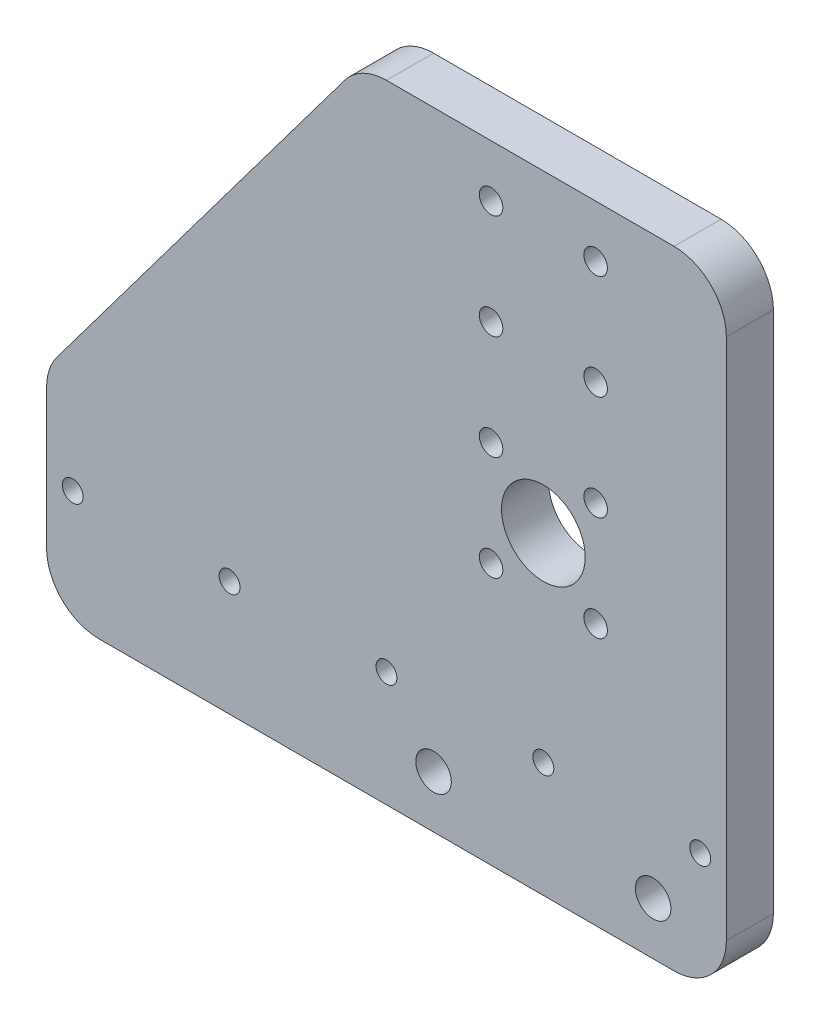
from build123d import *

# Parameters (mm, degrees)
BOSS_EXTRU_1_DEPTH      = 9
ESQUISSE2_R             = 2
ESQUISSE2_R_2           = 2.25
ENL_V_MAT_EXTRU_1_DEPTH = 178.146831753
ESQUISSE3_R             = 8
ESQUISSE3_R_2           = 3.4
ENL_V_MAT_EXTRU_2_DEPTH = 178.146831753
CONG_1_R                = 10


with BuildPart() as part:
    # Esquisse1 → Boss.-Extru.1 (new body)
    with BuildSketch(Plane.XY):
        Polygon((0, 0), (130, 0), (130, 120), (60, 120), (0, 40), align=None)
    extrude(amount=BOSS_EXTRU_1_DEPTH)

    # Esquisse2 → Enlèv. mat.-Extru.1 (cut, through all)
    with BuildSketch(Plane.XY.offset(9)):
        with Locations((65, 22)):
            Circle(ESQUISSE2_R)
        with Locations((35, 22)):
            Circle(ESQUISSE2_R)
        with Locations((5, 22)):
            Circle(ESQUISSE2_R)
        with Locations((125, 22)):
            Circle(ESQUISSE2_R)
        with Locations((95, 22)):
            Circle(ESQUISSE2_R)
        with Locations((85, 110)):
            Circle(ESQUISSE2_R_2)
        with Locations((85, 90)):
            Circle(ESQUISSE2_R_2)
        with Locations((105, 90)):
            Circle(ESQUISSE2_R_2)
        with Locations((105, 110)):
            Circle(ESQUISSE2_R_2)
        with Locations((105, 50)):
            Circle(ESQUISSE2_R_2)
        with Locations((105, 70)):
            Circle(ESQUISSE2_R_2)
        with Locations((85, 70)):
            Circle(ESQUISSE2_R_2)
        with Locations((85, 50)):
            Circle(ESQUISSE2_R_2)
    extrude(amount=-ENL_V_MAT_EXTRU_1_DEPTH, mode=Mode.SUBTRACT)

    # Esquisse3 → Enlèv. mat.-Extru.2 (cut, through all)
    with BuildSketch(Plane.XY.offset(9)):
        with Locations((95, 60)):
            Circle(ESQUISSE3_R)
        with Locations((74, 10)):
            Circle(ESQUISSE3_R_2)
        with Locations((116, 10)):
            Circle(ESQUISSE3_R_2)
    extrude(amount=-ENL_V_MAT_EXTRU_2_DEPTH, mode=Mode.SUBTRACT)

    # Congé1
    cong_1_edges = [part.edges().sort_by_distance(p)[0] for p in [
        (0, 40, 4.5),
        (60, 120, 4.5),
        (130, 120, 4.5),
        (130, 0, 4.5),
        (0, 0, 4.5),
    ]]
    fillet(cong_1_edges, radius=CONG_1_R)


solid = part.part
